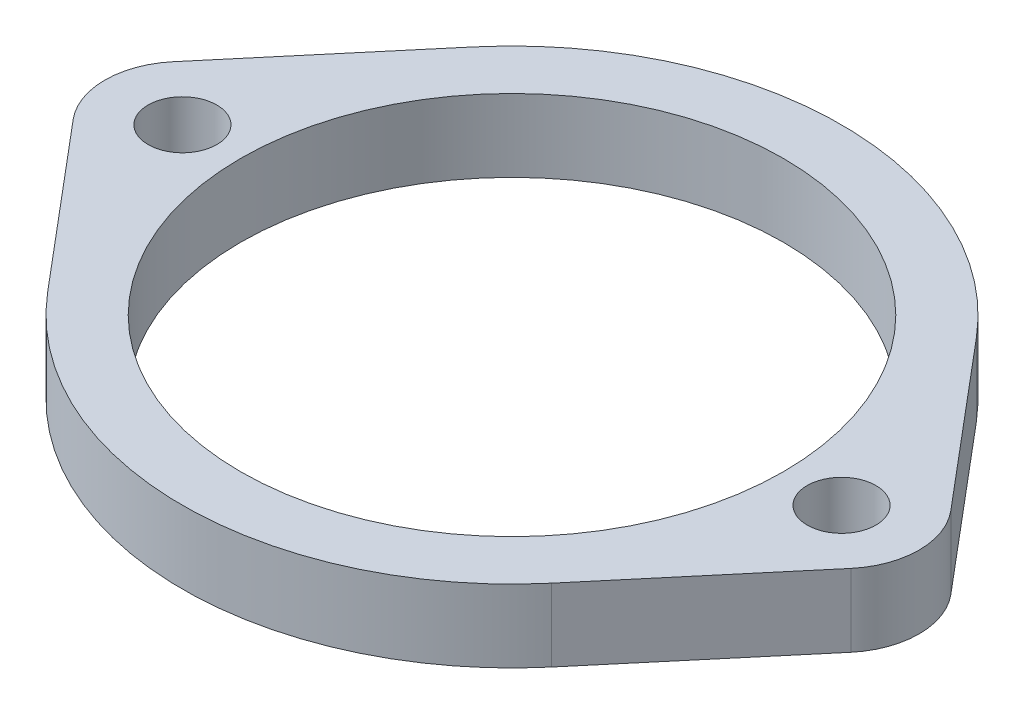
from build123d import *

# Parameters (mm, degrees)
SKETCH1_R           = 2.25
SKETCH1_R_2         = 17.78
BOSS_EXTRUDE1_DEPTH = 4.75996


with BuildPart() as part:
    # Sketch1 → Boss-Extrude1 (new body)
    with BuildSketch(Plane(origin=(0, 0, 0), x_dir=(1, 0, 0), z_dir=(0, 1, 0))):
        with BuildLine():
            Line((10.16, 35.502152961), (1.195294118, 24.863447755))
            ThreePointArc((1.195294118, 24.863447755), (0, 21.59), (1.195294118, 18.316552245))
            Line((1.195294118, 18.316552245), (10.16, 7.677847039))
            ThreePointArc((10.16, 7.677847039), (26.67, 0), (43.18, 7.677847039))
            Line((43.18, 7.677847039), (52.144705882, 18.316552245))
            ThreePointArc((52.144705882, 18.316552245), (53.34, 21.59), (52.144705882, 24.863447755))
            Line((52.144705882, 24.863447755), (43.18, 35.502152961))
            ThreePointArc((43.18, 35.502152961), (26.67, 43.18), (10.16, 35.502152961))
        make_face()
        with Locations((5.08, 21.59)):
            Circle(SKETCH1_R, mode=Mode.SUBTRACT)
        with Locations((26.67, 21.59)):
            Circle(SKETCH1_R_2, mode=Mode.SUBTRACT)
        with Locations((48.26, 21.59)):
            Circle(SKETCH1_R, mode=Mode.SUBTRACT)
    extrude(amount=BOSS_EXTRUDE1_DEPTH)


solid = part.part
